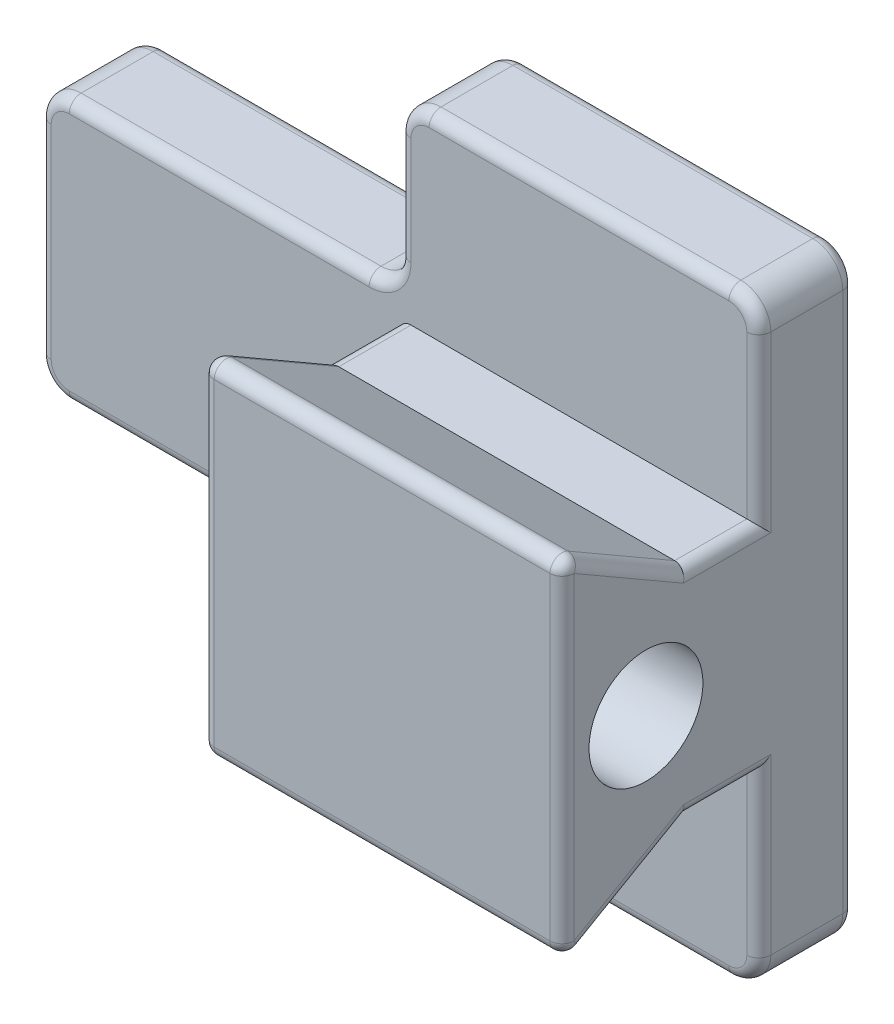
from build123d import *

# Parameters (mm, degrees)
BOSS_EXTRUDE1_DEPTH      = 3
BOSS_EXTRUDE2_DEPTH      = 3
M1_2X0_25_TAPPED_HOLE1_D = 0.95
FILLET1_R                = 0.25
FILLET2_R                = 0.1


with BuildPart() as part:
    # Sketch1 → Boss-Extrude1 (new body)
    with BuildSketch(Plane(origin=(0, 0, 0), x_dir=(0, 0, -1), z_dir=(1, 0, 0))):
        Polygon((0, 1.5), (0, -1.5), (1.039230485, -0.9), (1.641290416, -0.9), (1.641290416, -2.5), (2.441290416, -2.5), (2.441290416, 2.5), (1.641290416, 2.5), (1.641290416, 0.9), (1.039230485, 0.9), align=None)
    extrude(amount=BOSS_EXTRUDE1_DEPTH)

    # Sketch1<4> → Boss-Extrude2 (add)
    with BuildSketch(Plane(origin=(0, 0, 0), x_dir=(0, 0, -1), z_dir=(1, 0, 0))):
        Polygon((1.641290416, 0.9), (1.641290416, -0.9), (1.641290416, -1.1), (2.441290416, -1.1), (2.441290416, 1.1), (1.641290416, 1.1), align=None)
    extrude(amount=-BOSS_EXTRUDE2_DEPTH)

    # M1.2x0.25 Tapped Hole1 (through all)
    with Locations(Plane.ZY):
        with Locations((-0.7, 0)):
            Hole(M1_2X0_25_TAPPED_HOLE1_D / 2)

    # Fillet1
    fillet1_edges = [part.edges().sort_by_distance(p)[0] for p in [
        (0, -1.1, -2.041290416),
        (0, -2.5, -2.041290416),
        (3, -2.5, -2.041290416),
        (3, 2.5, -2.041290416),
        (0, 2.5, -2.041290416),
        (0, 1.1, -2.041290416),
        (-3, -1.1, -2.041290416),
        (-3, 1.1, -2.041290416),
    ]]
    fillet(fillet1_edges, radius=FILLET1_R)

    # Fillet2
    fillet2_edges = [part.edges().sort_by_distance(p)[0] for p in [
        (1.5, 1.5, 0),
        (1.5, -1.5, 0),
        (0, 0, 0),
        (0, 1.2, -0.519615242),
        (0, 0.9, -1.34026045),
        (0, -1.2, -0.519615242),
        (0, -0.9, -1.34026045),
        (3, -1.2, -0.519615242),
        (3, 0, 0),
        (3, 1.2, -0.519615242),
        (3, -0.9, -1.34026045),
        (3, 0.9, -1.34026045),
        (2.926776695, 2.426776695, -2.441290416),
        (3, 0, -2.441290416),
        (2.926776695, -2.426776695, -2.441290416),
        (1.5, 2.5, -2.441290416),
        (0.073223305, 2.426776695, -2.441290416),
        (0, 1.8, -2.441290416),
        (1.5, -2.5, -2.441290416),
        (0.073223305, -2.426776695, -2.441290416),
        (-0.073223305, -1.173223305, -2.441290416),
        (-1.5, -1.1, -2.441290416),
        (-0.073223305, 1.173223305, -2.441290416),
        (-1.5, 1.1, -2.441290416),
        (-2.926776695, 1.026776695, -2.441290416),
        (-2.926776695, -1.026776695, -2.441290416),
        (-3, 0, -2.441290416),
        (3, 1.575, -1.641290416),
        (3, -1.575, -1.641290416),
        (2.926776695, -2.426776695, -1.641290416),
        (1.5, -2.5, -1.641290416),
        (0.073223305, -2.426776695, -1.641290416),
        (-0.073223305, -1.173223305, -1.641290416),
        (0, 1.8, -1.641290416),
        (2.926776695, 2.426776695, -1.641290416),
        (1.5, 2.5, -1.641290416),
        (0.073223305, 2.426776695, -1.641290416),
        (-0.073223305, 1.173223305, -1.641290416),
        (-1.5, 1.1, -1.641290416),
        (-2.926776695, 1.026776695, -1.641290416),
        (-3, 0, -1.641290416),
        (-2.926776695, -1.026776695, -1.641290416),
        (-1.5, -1.1, -1.641290416),
    ]]
    fillet(fillet2_edges, radius=FILLET2_R)


solid = part.part
